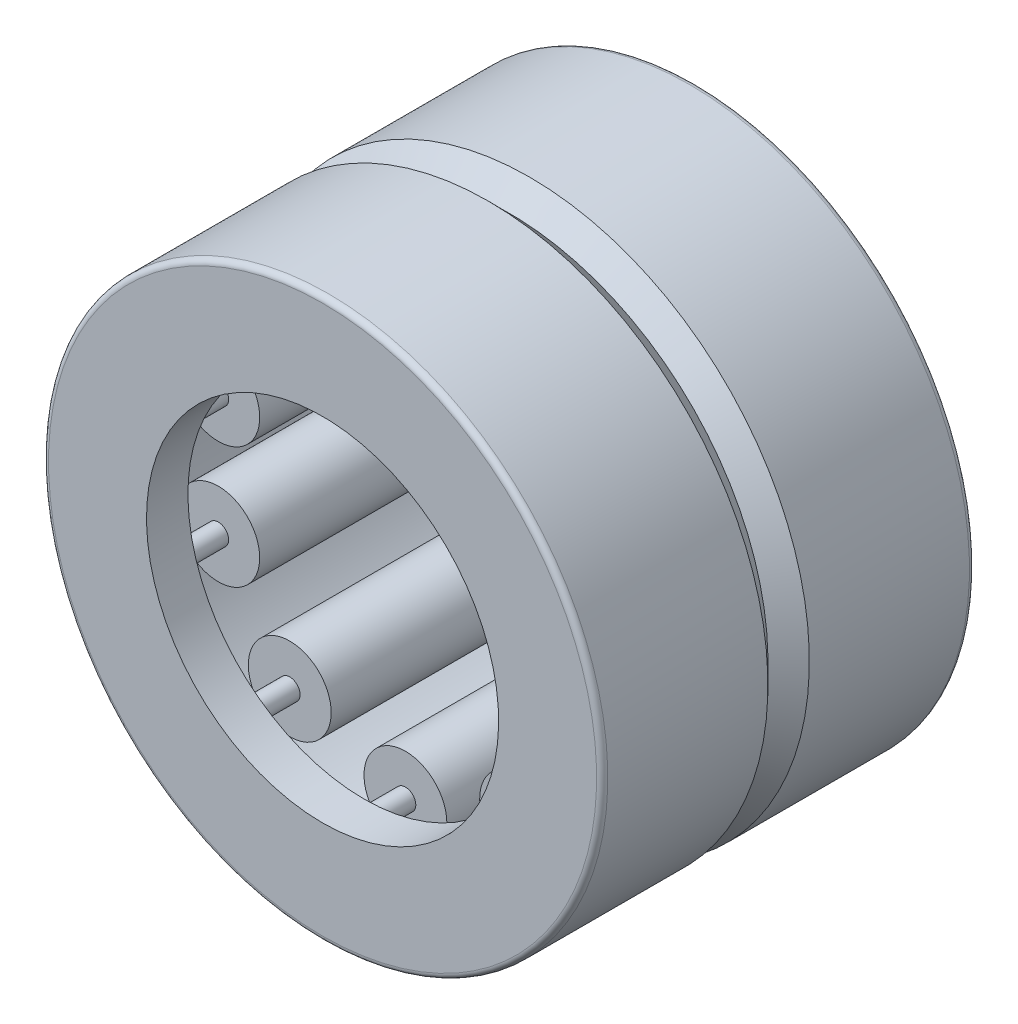
from build123d import *

# Parameters (mm, degrees)
SKETCH2_W         = 10.583333334
SKETCH2_H         = 1.5875
SKETCH3_W         = 14.816666666
SKETCH3_H         = 0.529166666
CIRPATTERN1_COUNT = 10
FILLET1_R         = 0.28575


with BuildPart() as part:
    # Sketch1 → Revolve1 (revolve)
    with BuildSketch(Plane(origin=(0, 0, 0), x_dir=(0, 0, -1), z_dir=(1, 0, 0))):
        Polygon((-9.525, 14.2875), (9.525, 14.2875), (9.525, 8.995833333), (7.408333333, 8.995833333), (7.408333333, 12.170833333), (-7.408333333, 12.170833333), (-7.408333333, 8.995833333), (-9.525, 8.995833333), align=None)
    revolve(axis=Axis((0, 0, 9.525), (0, 0, -1)))

    # Fillet1
    fillet1_edges = [part.edges().sort_by_distance(p)[0] for p in [
        (0, -14.2875, -9.525),
        (0, -14.2875, 9.525),
    ]]
    fillet(fillet1_edges, radius=FILLET1_R)

    # Sketch4 → Cut-Revolve1 (revolve, cut)
    with BuildSketch(Plane(origin=(0, 0, 0), x_dir=(0, 0, -1), z_dir=(1, 0, 0))):
        Polygon((-1.058333333, 14.2875), (0, 13.229166667), (1.058333333, 14.2875), align=None)
    revolve(axis=Axis((0, 0, 9.525), (0, 0, -1)), mode=Mode.SUBTRACT)


with BuildPart() as body_2:
    # Sketch2 → Revolve2 (revolve)
    with BuildSketch(Plane(origin=(0, 0, 0), x_dir=(0, 0, -1), z_dir=(1, 0, 0))):
        with Locations((0, 11.377083333)):
            Rectangle(SKETCH2_W, SKETCH2_H)
    revolve(axis=Axis((0, 10.054166667, 5.291666667), (0, 0, -1)))


with BuildPart() as body_3:
    # Sketch3 → Revolve3 (revolve)
    with BuildSketch(Plane(origin=(0, 0, 0), x_dir=(0, 0, -1), z_dir=(1, 0, 0))):
        with Locations((0, 10.31875)):
            Rectangle(SKETCH3_W, SKETCH3_H)
    revolve(axis=Axis((0, 10.054166667, 7.408333333), (0, 0, -1)))


with BuildPart() as cirpattern1_1:
    # CirPattern1: pattern copy
    add(body_3.part.rotate(Axis((0, 0, -9.525), (0, 0, 1)), 1 * 360 / CIRPATTERN1_COUNT))


with BuildPart() as cirpattern1_2:
    # CirPattern1: pattern copy
    add(body_3.part.rotate(Axis((0, 0, -9.525), (0, 0, 1)), 2 * 360 / CIRPATTERN1_COUNT))


with BuildPart() as cirpattern1_3:
    # CirPattern1: pattern copy
    add(body_3.part.rotate(Axis((0, 0, -9.525), (0, 0, 1)), 3 * 360 / CIRPATTERN1_COUNT))


with BuildPart() as cirpattern1_4:
    # CirPattern1: pattern copy
    add(body_3.part.rotate(Axis((0, 0, -9.525), (0, 0, 1)), 4 * 360 / CIRPATTERN1_COUNT))


with BuildPart() as cirpattern1_5:
    # CirPattern1: pattern copy
    add(body_3.part.rotate(Axis((0, 0, -9.525), (0, 0, 1)), 5 * 360 / CIRPATTERN1_COUNT))


with BuildPart() as cirpattern1_6:
    # CirPattern1: pattern copy
    add(body_3.part.rotate(Axis((0, 0, -9.525), (0, 0, 1)), 6 * 360 / CIRPATTERN1_COUNT))


with BuildPart() as cirpattern1_7:
    # CirPattern1: pattern copy
    add(body_3.part.rotate(Axis((0, 0, -9.525), (0, 0, 1)), 7 * 360 / CIRPATTERN1_COUNT))


with BuildPart() as cirpattern1_8:
    # CirPattern1: pattern copy
    add(body_3.part.rotate(Axis((0, 0, -9.525), (0, 0, 1)), 8 * 360 / CIRPATTERN1_COUNT))


with BuildPart() as cirpattern1_9:
    # CirPattern1: pattern copy
    add(body_3.part.rotate(Axis((0, 0, -9.525), (0, 0, 1)), 9 * 360 / CIRPATTERN1_COUNT))


with BuildPart() as cirpattern1_10:
    # CirPattern1: pattern copy
    add(body_2.part.rotate(Axis((0, 0, -9.525), (0, 0, 1)), 1 * 360 / CIRPATTERN1_COUNT))


with BuildPart() as cirpattern1_11:
    # CirPattern1: pattern copy
    add(body_2.part.rotate(Axis((0, 0, -9.525), (0, 0, 1)), 2 * 360 / CIRPATTERN1_COUNT))


with BuildPart() as cirpattern1_12:
    # CirPattern1: pattern copy
    add(body_2.part.rotate(Axis((0, 0, -9.525), (0, 0, 1)), 3 * 360 / CIRPATTERN1_COUNT))


with BuildPart() as cirpattern1_13:
    # CirPattern1: pattern copy
    add(body_2.part.rotate(Axis((0, 0, -9.525), (0, 0, 1)), 4 * 360 / CIRPATTERN1_COUNT))


with BuildPart() as cirpattern1_14:
    # CirPattern1: pattern copy
    add(body_2.part.rotate(Axis((0, 0, -9.525), (0, 0, 1)), 5 * 360 / CIRPATTERN1_COUNT))


with BuildPart() as cirpattern1_15:
    # CirPattern1: pattern copy
    add(body_2.part.rotate(Axis((0, 0, -9.525), (0, 0, 1)), 6 * 360 / CIRPATTERN1_COUNT))


with BuildPart() as cirpattern1_16:
    # CirPattern1: pattern copy
    add(body_2.part.rotate(Axis((0, 0, -9.525), (0, 0, 1)), 7 * 360 / CIRPATTERN1_COUNT))


with BuildPart() as cirpattern1_17:
    # CirPattern1: pattern copy
    add(body_2.part.rotate(Axis((0, 0, -9.525), (0, 0, 1)), 8 * 360 / CIRPATTERN1_COUNT))


with BuildPart() as cirpattern1_18:
    # CirPattern1: pattern copy
    add(body_2.part.rotate(Axis((0, 0, -9.525), (0, 0, 1)), 9 * 360 / CIRPATTERN1_COUNT))


solid = Compound([part.part, body_2.part, body_3.part, cirpattern1_1.part, cirpattern1_2.part, cirpattern1_3.part, cirpattern1_4.part, cirpattern1_5.part, cirpattern1_6.part, cirpattern1_7.part, cirpattern1_8.part, cirpattern1_9.part, cirpattern1_10.part, cirpattern1_11.part, cirpattern1_12.part, cirpattern1_13.part, cirpattern1_14.part, cirpattern1_15.part, cirpattern1_16.part, cirpattern1_17.part, cirpattern1_18.part])
